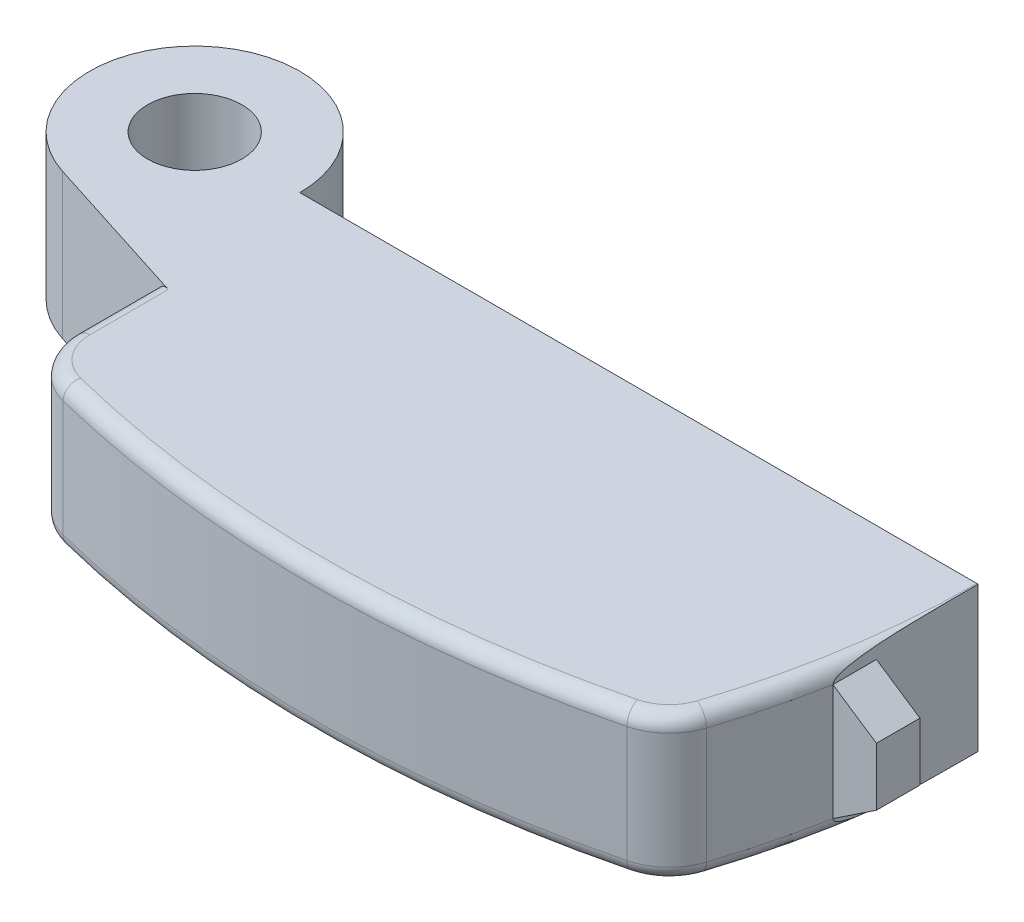
from build123d import *

# Parameters (mm, degrees)
SKETCH1_R           = 1.625
BOSS_EXTRUDE1_DEPTH = 2.5
BOSS_EXTRUDE2_DEPTH = 1.5
FILLET1_R           = 0.5


with BuildPart() as part:
    # Sketch1 → Boss-Extrude1 (new, symmetric)
    with BuildSketch(Plane(origin=(0, 0, 0), x_dir=(1, 0, 0), z_dir=(0, 1, 0))):
        with BuildLine():
            Line((3.625, 0), (27, 0))
            Line((27, 0), (27, -5))
            ThreePointArc((27, -5), (26.615495492, -6.753917362), (26.117184331, -8.478955279))
            ThreePointArc((26.117184331, -8.478955279), (25.579877562, -9.323196183), (24.700839791, -9.801457476))
            ThreePointArc((24.700839791, -9.801457476), (14.982460411, -11), (5.264081031, -9.801457476))
            ThreePointArc((5.264081031, -9.801457476), (4.173320271, -9.091864602), (3.75, -7.861384602))
            Line((3.75, -7.861384602), (3.75, -5))
            Line((3.75, -5), (-1.100887775, -3.453790831))
            ThreePointArc((-1.100887775, -3.453790831), (-2.138914072, 2.926716862), (3.625, 0))
        make_face()
        Circle(SKETCH1_R, mode=Mode.SUBTRACT)
    extrude(amount=BOSS_EXTRUDE1_DEPTH, both=True)

    # Sketch3 → Boss-Extrude2 (add)
    with BuildSketch(Plane(origin=(0, 0, 5), x_dir=(-1, 0, 0), z_dir=(0, 0, -1))):
        Polygon((-27, -2), (-28.5, -1), (-28.5, 1), (-27, 2), align=None)
    extrude(amount=BOSS_EXTRUDE2_DEPTH)

    # Fillet1
    fillet1_edges = [part.edges().sort_by_distance(p)[0] for p in [
        (3.75, 2.5, 6.430692301),
        (4.173320271, 2.5, 9.091864602),
        (26.615495492, 2.5, 6.753917362),
        (25.579877562, 2.5, 9.323196183),
        (3.75, -2.5, 6.430692301),
        (4.173320271, -2.5, 9.091864602),
        (26.615495492, -2.5, 6.753917362),
        (25.579877562, -2.5, 9.323196183),
        (14.982460411, 2.5, 11),
        (14.982460411, -2.5, 11),
    ]]
    fillet(fillet1_edges, radius=FILLET1_R)


solid = part.part
